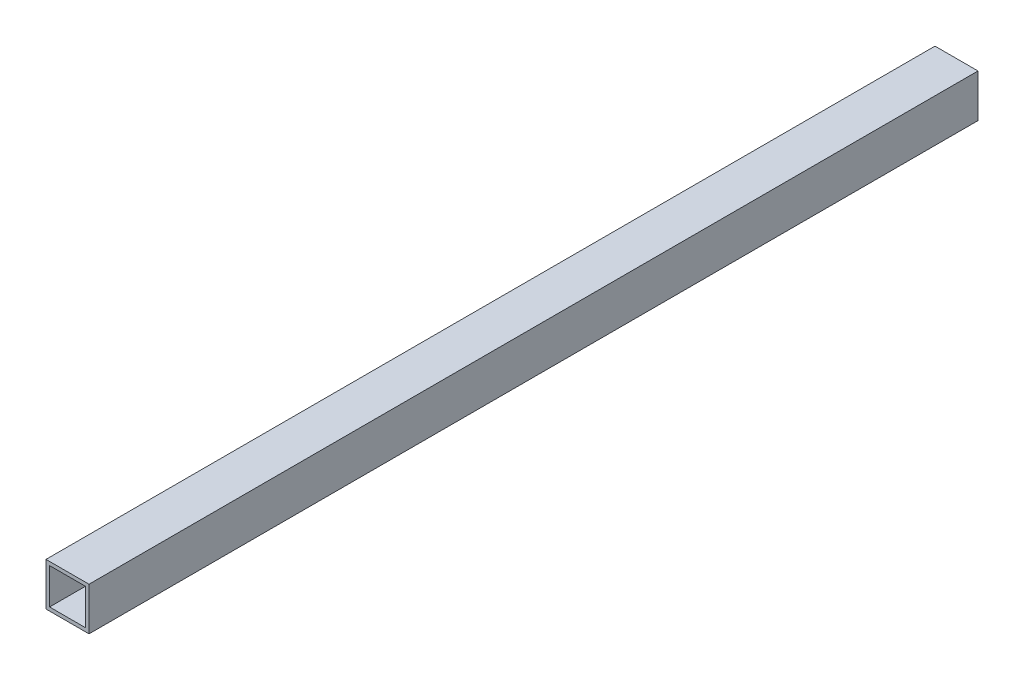
from build123d import *

# Parameters (mm, degrees)
SKETCH1_W           = 19.05
SKETCH1_H           = 19.05
SKETCH1_W_2         = 15.875
SKETCH1_H_2         = 15.875
BOSS_EXTRUDE1_DEPTH = 196.85


with BuildPart() as part:
    # Sketch1 → Boss-Extrude1 (new, symmetric)
    with BuildSketch(Plane.XY):
        Rectangle(SKETCH1_W, SKETCH1_H)
        Rectangle(SKETCH1_W_2, SKETCH1_H_2, mode=Mode.SUBTRACT)
    extrude(amount=BOSS_EXTRUDE1_DEPTH, both=True)


solid = part.part
